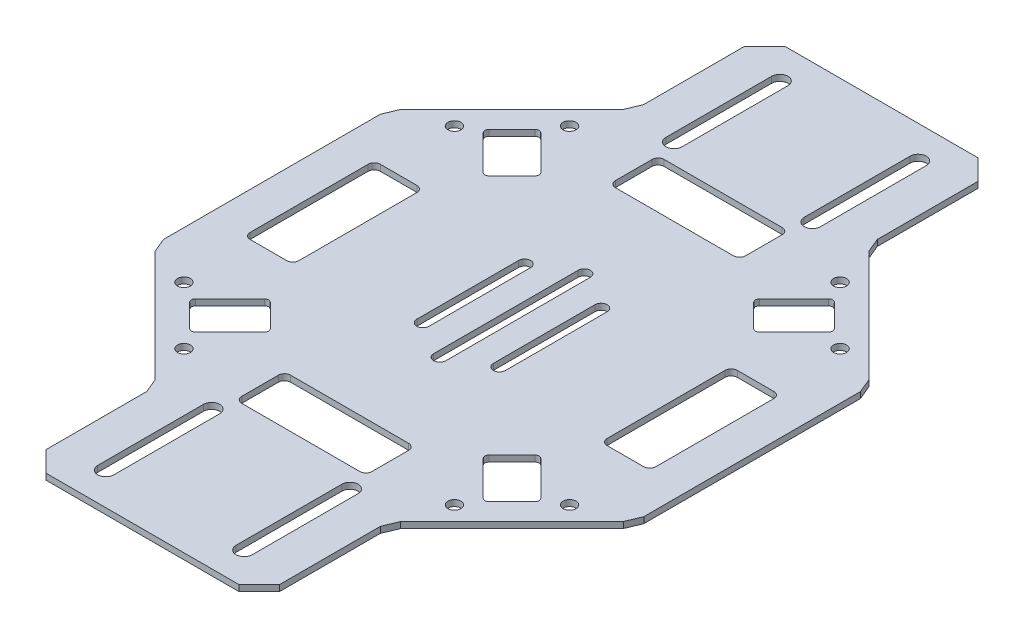
from build123d import *

# Parameters (mm, degrees)
SKETCH1_R           = 1.6
BOSS_EXTRUDE1_DEPTH = 0.75


with BuildPart() as part:
    # Sketch1 → Boss-Extrude1 (new, symmetric)
    with BuildSketch(Plane.XZ):
        Polygon((-59, 26.610173055), (-59, -26.610173055), (-57.535533906, -30.145706961), (-30.164466094, -57.516774773), (-28.7, -61.052308679), (-28.7, -85.8), (-23.7, -90.8), (23.7, -90.8), (28.7, -85.8), (28.7, -61.052308679), (30.164466094, -57.516774773), (57.535533906, -30.145706961), (59, -26.610173055), (59, 26.610173055), (57.535533906, 30.145706961), (30.164466094, 57.516774773), (28.7, 61.052308679), (28.7, 85.8), (23.7, 90.8), (-23.7, 90.8), (-28.7, 85.8), (-28.7, 61.052308679), (-30.164466094, 57.516774773), (-57.535533906, 30.145706961), align=None)
        with Locations((-33.234018716, -47.376154339)):
            Circle(SKETCH1_R, mode=Mode.SUBTRACT)
        with Locations((-47.376154339, -33.234018716)):
            Circle(SKETCH1_R, mode=Mode.SUBTRACT)
        with Locations((-47.376154339, 33.234018716)):
            Circle(SKETCH1_R, mode=Mode.SUBTRACT)
        with Locations((-33.234018716, 47.376154339)):
            Circle(SKETCH1_R, mode=Mode.SUBTRACT)
        with Locations((33.234018716, 47.376154339)):
            Circle(SKETCH1_R, mode=Mode.SUBTRACT)
        with Locations((47.376154339, 33.234018716)):
            Circle(SKETCH1_R, mode=Mode.SUBTRACT)
        with Locations((47.376154339, -33.234018716)):
            Circle(SKETCH1_R, mode=Mode.SUBTRACT)
        with Locations((33.234018716, -47.376154339)):
            Circle(SKETCH1_R, mode=Mode.SUBTRACT)
        with BuildLine():
            Line((-19, -82.8), (-19, -56.8))
            ThreePointArc((-19, -56.8), (-17, -54.8), (-15, -56.8))
            Line((-15, -56.8), (-15, -82.8))
            ThreePointArc((-15, -82.8), (-17, -84.8), (-19, -82.8))
        make_face(mode=Mode.SUBTRACT)
        with BuildLine():
            Line((19, 82.8), (19, 56.8))
            ThreePointArc((19, 56.8), (17, 54.8), (15, 56.8))
            Line((15, 56.8), (15, 82.8))
            ThreePointArc((15, 82.8), (17, 84.8), (19, 82.8))
        make_face(mode=Mode.SUBTRACT)
        with BuildLine():
            Line((-15, 82.8), (-15, 56.8))
            ThreePointArc((-15, 56.8), (-17, 54.8), (-19, 56.8))
            Line((-19, 56.8), (-19, 82.8))
            ThreePointArc((-19, 82.8), (-17, 84.8), (-15, 82.8))
        make_face(mode=Mode.SUBTRACT)
        with BuildLine():
            Line((-14.5, 51.9), (14.5, 51.9))
            ThreePointArc((14.5, 51.9), (15.560660172, 51.460660172), (16, 50.4))
            Line((16, 50.4), (16, 41.4))
            ThreePointArc((16, 41.4), (15.560660172, 40.339339828), (14.5, 39.9))
            Line((14.5, 39.9), (-14.5, 39.9))
            ThreePointArc((-14.5, 39.9), (-15.560660172, 40.339339828), (-16, 41.4))
            Line((-16, 41.4), (-16, 50.4))
            ThreePointArc((-16, 50.4), (-15.560660172, 51.460660172), (-14.5, 51.9))
        make_face(mode=Mode.SUBTRACT)
        with BuildLine():
            Line((16, -41.4), (16, -50.4))
            ThreePointArc((16, -50.4), (15.560660172, -51.460660172), (14.5, -51.9))
            Line((14.5, -51.9), (-14.5, -51.9))
            ThreePointArc((-14.5, -51.9), (-15.560660172, -51.460660172), (-16, -50.4))
            Line((-16, -50.4), (-16, -41.4))
            ThreePointArc((-16, -41.4), (-15.560660172, -40.339339828), (-14.5, -39.9))
            Line((-14.5, -39.9), (14.5, -39.9))
            ThreePointArc((14.5, -39.9), (15.560660172, -40.339339828), (16, -41.4))
        make_face(mode=Mode.SUBTRACT)
        with BuildLine():
            Line((19, -56.8), (19, -82.8))
            ThreePointArc((19, -82.8), (17, -84.8), (15, -82.8))
            Line((15, -82.8), (15, -56.8))
            ThreePointArc((15, -56.8), (17, -54.8), (19, -56.8))
        make_face(mode=Mode.SUBTRACT)
        with BuildLine():
            Line((-10.9, -12.5), (-10.9, 12.5))
            ThreePointArc((-10.9, 12.5), (-9.4, 14), (-7.9, 12.5))
            Line((-7.9, 12.5), (-7.9, -12.5))
            ThreePointArc((-7.9, -12.5), (-9.4, -14), (-10.9, -12.5))
        make_face(mode=Mode.SUBTRACT)
        with BuildLine():
            Line((10.9, 12.5), (10.9, -12.5))
            ThreePointArc((10.9, -12.5), (9.4, -14), (7.9, -12.5))
            Line((7.9, -12.5), (7.9, 12.5))
            ThreePointArc((7.9, 12.5), (9.4, 14), (10.9, 12.5))
        make_face(mode=Mode.SUBTRACT)
        with BuildLine():
            Line((-32.526911935, -26.870057685), (-26.870057685, -32.526911935))
            ThreePointArc((-26.870057685, -32.526911935), (-26.577164466, -33.234018716), (-26.870057685, -33.941125497))
            Line((-26.870057685, -33.941125497), (-35.355339059, -42.426406871))
            ThreePointArc((-35.355339059, -42.426406871), (-36.062445841, -42.71930009), (-36.769552622, -42.426406871))
            Line((-36.769552622, -42.426406871), (-42.426406871, -36.769552622))
            ThreePointArc((-42.426406871, -36.769552622), (-42.71930009, -36.062445841), (-42.426406871, -35.355339059))
            Line((-42.426406871, -35.355339059), (-33.941125497, -26.870057685))
            ThreePointArc((-33.941125497, -26.870057685), (-33.234018716, -26.577164466), (-32.526911935, -26.870057685))
        make_face(mode=Mode.SUBTRACT)
        with BuildLine():
            Line((-26.870057685, 32.526911935), (-32.526911935, 26.870057685))
            ThreePointArc((-32.526911935, 26.870057685), (-33.234018716, 26.577164466), (-33.941125497, 26.870057685))
            Line((-33.941125497, 26.870057685), (-42.426406871, 35.355339059))
            ThreePointArc((-42.426406871, 35.355339059), (-42.71930009, 36.062445841), (-42.426406871, 36.769552622))
            Line((-42.426406871, 36.769552622), (-36.769552622, 42.426406871))
            ThreePointArc((-36.769552622, 42.426406871), (-36.062445841, 42.71930009), (-35.355339059, 42.426406871))
            Line((-35.355339059, 42.426406871), (-26.870057685, 33.941125497))
            ThreePointArc((-26.870057685, 33.941125497), (-26.577164466, 33.234018716), (-26.870057685, 32.526911935))
        make_face(mode=Mode.SUBTRACT)
        with BuildLine():
            Line((48.35, -16), (39.35, -16))
            ThreePointArc((39.35, -16), (38.289339828, -15.560660172), (37.85, -14.5))
            Line((37.85, -14.5), (37.85, 14.5))
            ThreePointArc((37.85, 14.5), (38.289339828, 15.560660172), (39.35, 16))
            Line((39.35, 16), (48.35, 16))
            ThreePointArc((48.35, 16), (49.410660172, 15.560660172), (49.85, 14.5))
            Line((49.85, 14.5), (49.85, -14.5))
            ThreePointArc((49.85, -14.5), (49.410660172, -15.560660172), (48.35, -16))
        make_face(mode=Mode.SUBTRACT)
        with BuildLine():
            Line((-39.35, -16), (-48.35, -16))
            ThreePointArc((-48.35, -16), (-49.410660172, -15.560660172), (-49.85, -14.5))
            Line((-49.85, -14.5), (-49.85, 14.5))
            ThreePointArc((-49.85, 14.5), (-49.410660172, 15.560660172), (-48.35, 16))
            Line((-48.35, 16), (-39.35, 16))
            ThreePointArc((-39.35, 16), (-38.289339828, 15.560660172), (-37.85, 14.5))
            Line((-37.85, 14.5), (-37.85, -14.5))
            ThreePointArc((-37.85, -14.5), (-38.289339828, -15.560660172), (-39.35, -16))
        make_face(mode=Mode.SUBTRACT)
        with BuildLine():
            Line((26.870057685, -32.526911935), (32.526911935, -26.870057685))
            ThreePointArc((32.526911935, -26.870057685), (33.234018716, -26.577164466), (33.941125497, -26.870057685))
            Line((33.941125497, -26.870057685), (42.426406871, -35.355339059))
            ThreePointArc((42.426406871, -35.355339059), (42.71930009, -36.062445841), (42.426406871, -36.769552622))
            Line((42.426406871, -36.769552622), (36.769552622, -42.426406871))
            ThreePointArc((36.769552622, -42.426406871), (36.062445841, -42.71930009), (35.355339059, -42.426406871))
            Line((35.355339059, -42.426406871), (26.870057685, -33.941125497))
            ThreePointArc((26.870057685, -33.941125497), (26.577164466, -33.234018716), (26.870057685, -32.526911935))
        make_face(mode=Mode.SUBTRACT)
        with BuildLine():
            Line((32.526911935, 26.870057685), (26.870057685, 32.526911935))
            ThreePointArc((26.870057685, 32.526911935), (26.577164466, 33.234018716), (26.870057685, 33.941125497))
            Line((26.870057685, 33.941125497), (35.355339059, 42.426406871))
            ThreePointArc((35.355339059, 42.426406871), (36.062445841, 42.71930009), (36.769552622, 42.426406871))
            Line((36.769552622, 42.426406871), (42.426406871, 36.769552622))
            ThreePointArc((42.426406871, 36.769552622), (42.71930009, 36.062445841), (42.426406871, 35.355339059))
            Line((42.426406871, 35.355339059), (33.941125497, 26.870057685))
            ThreePointArc((33.941125497, 26.870057685), (33.234018716, 26.577164466), (32.526911935, 26.870057685))
        make_face(mode=Mode.SUBTRACT)
        with BuildLine():
            Line((1.5, 17.75), (1.5, -17.75))
            ThreePointArc((1.5, -17.75), (0, -19.25), (-1.5, -17.75))
            Line((-1.5, -17.75), (-1.5, 17.75))
            ThreePointArc((-1.5, 17.75), (0, 19.25), (1.5, 17.75))
        make_face(mode=Mode.SUBTRACT)
    extrude(amount=BOSS_EXTRUDE1_DEPTH, both=True)


solid = part.part
